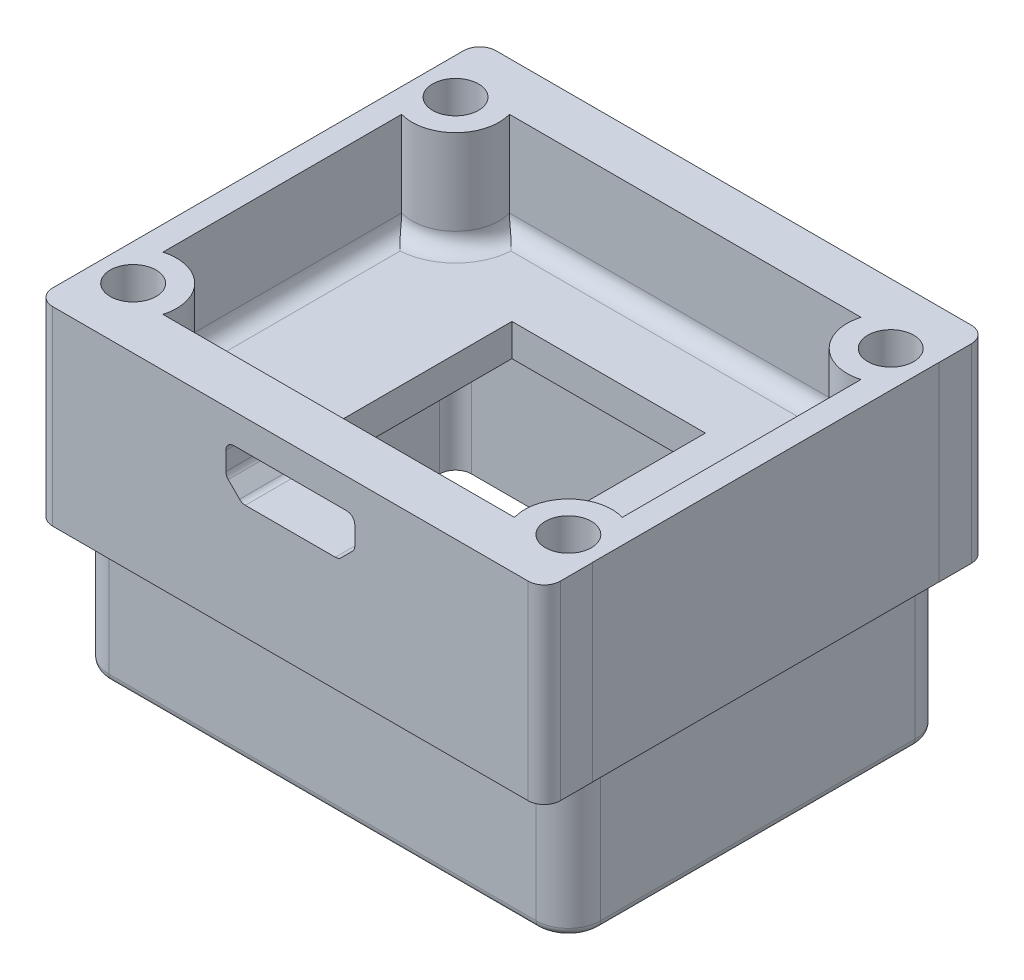
from build123d import *

# Parameters (mm, degrees)
SKETCH_1_W               = 31.500375693
SKETCH_1_H               = 27.5
EXTRUDE_1_DEPTH          = 18.8
SKETCH_2_W               = 0.007172267
SKETCH_2_H               = 21.5
CUT_EXTRUDE_1_DEPTH      = 18.8
SKETCH_3_W               = 30.5
SKETCH_3_H               = 23.5
EXTRUDE_2_DEPTH          = 1.7
SKETCH_4_W               = 28.5
SKETCH_4_H               = 21.5
CUT_EXTRUDE_2_DEPTH      = 12.2
SKETCH_5_W               = 15.8
SKETCH_5_H               = 15.8
EXTRUDE_3_DEPTH          = 0.8
CUT_EXTRUDE_3_DEPTH      = 6.3
SKETCH_7_W               = 14.2
SKETCH_7_H               = 14.2
CUT_EXTRUDE_4_DEPTH      = 0.8
SKETCH_8_W               = 12
SKETCH_8_H               = 12
CUT_EXTRUDE_5_DEPTH      = 26.276152686
CUT_EXTRUDE_6_REACH      = 39.211
HOLE_WIZARD_M2_5_1_D     = 2.85
HOLE_WIZARD_M2_5_1_DEPTH = 5.5
FILLET_1_R               = 2
FILLET_2_R               = 0.5
FILLET_3_R               = 1
CUT_EXTRUDE_8_DEPTH      = 7


with BuildPart() as part:
    # 草图1 → 凸台-拉伸1 (new body)
    with BuildSketch(Plane(origin=(0, 19.5, 0), x_dir=(1, 0, 0), z_dir=(0, 1, 0))):
        with Locations((0.003586134, 0)):
            Rectangle(SKETCH_1_W, SKETCH_1_H)
    extrude(amount=-EXTRUDE_1_DEPTH)

    # 草图2 → 切除-拉伸1 (cut)
    with BuildSketch(Plane.XZ.offset(-0.7)):
        with Locations((15.750187847, 0)):
            Rectangle(SKETCH_2_W, SKETCH_2_H)
    extrude(amount=-CUT_EXTRUDE_1_DEPTH, mode=Mode.SUBTRACT)

    # 草图3 → 凸台-拉伸2 (add)
    with BuildSketch(Plane.XZ.offset(-0.7)):
        Rectangle(SKETCH_3_W, SKETCH_3_H)
    extrude(amount=EXTRUDE_2_DEPTH)

    # 草图4 → 切除-拉伸2 (cut)
    with BuildSketch(Plane.XZ.offset(1)):
        Rectangle(SKETCH_4_W, SKETCH_4_H)
    extrude(amount=-CUT_EXTRUDE_2_DEPTH, mode=Mode.SUBTRACT)

    # 草图5 → 凸台-拉伸3 (add)
    with BuildSketch(Plane.XZ.offset(-11.2)):
        Rectangle(SKETCH_5_W, SKETCH_5_H)
    extrude(amount=EXTRUDE_3_DEPTH)

    # 草图6 → 切除-拉伸3 (cut)
    with BuildSketch(Plane(origin=(0, 19.5, 0), x_dir=(-1, 0, 0), z_dir=(0, 1, 0))):
        with BuildLine():
            Line((-14.25, 7.40625753), (-14.25, -7.40625753))
            ThreePointArc((-14.25, -7.40625753), (-11.590811691, -8.090811691), (-10.90625753, -10.75))
            Line((-10.90625753, -10.75), (10.90625753, -10.75))
            ThreePointArc((10.90625753, -10.75), (11.590811691, -8.090811691), (14.25, -7.40625753))
            Line((14.25, -7.40625753), (14.25, 7.40625753))
            ThreePointArc((14.25, 7.40625753), (11.590811691, 8.090811691), (10.90625753, 10.75))
            Line((10.90625753, 10.75), (-10.90625753, 10.75))
            ThreePointArc((-10.90625753, 10.75), (-11.590811691, 8.090811691), (-14.25, 7.40625753))
        make_face()
    extrude(amount=-CUT_EXTRUDE_3_DEPTH, mode=Mode.SUBTRACT)

    # 草图7 → 切除-拉伸4 (cut)
    with BuildSketch(Plane.XZ.offset(-10.4)):
        Rectangle(SKETCH_7_W, SKETCH_7_H)
    extrude(amount=-CUT_EXTRUDE_4_DEPTH, mode=Mode.SUBTRACT)

    # 草图8 → 切除-拉伸5 (cut, through all)
    with BuildSketch(Plane(origin=(0, 13.2, 0), x_dir=(-1, 0, 0), z_dir=(0, 1, 0))):
        Rectangle(SKETCH_8_W, SKETCH_8_H)
    extrude(amount=-CUT_EXTRUDE_5_DEPTH, mode=Mode.SUBTRACT)

    # 草图9 → 切除-拉伸6 (cut, up to next)
    with BuildSketch(Plane.XY.offset(13.75), mode=Mode.PRIVATE) as cut_extrude_6_sk1:
        Polygon((-4, 17.65), (-4, 15.8), (-3, 14.8), (3, 14.8), (4, 15.8), (4, 17.65), align=None)
    cut_extrude_6_tool1 = extrude(cut_extrude_6_sk1.sketch, amount=-CUT_EXTRUDE_6_REACH, mode=Mode.PRIVATE) & part.part
    add(cut_extrude_6_tool1.solids().sort_by_distance((0, 16.275076, 13.75))[0], mode=Mode.SUBTRACT)

    # M2.5 间隙孔1
    with Locations(Plane(origin=(0, 19.5, 0), x_dir=(1, 0, 0), z_dir=(0, 1, 0))):
        with Locations((13.5, 10), (13.5, -10), (-13.5, -10), (-13.5, 10)):
            Hole(HOLE_WIZARD_M2_5_1_D / 2, depth=HOLE_WIZARD_M2_5_1_DEPTH)

    # 圆角1
    fillet_1_edges = [part.edges().sort_by_distance(p)[0] for p in [
        (15.25, -0.15, -11.75),
        (15.25, -0.15, 11.75),
        (-15.25, -0.15, 11.75),
        (-15.25, -0.15, -11.75),
    ]]
    fillet(fillet_1_edges, radius=FILLET_1_R)

    # 圆角2
    fillet_2_edges = [part.edges().sort_by_distance(p)[0] for p in [
        (-4, 17.65, 12.25),
        (4, 17.65, 12.25),
        (4, 15.8, 12.25),
        (3, 14.8, 12.25),
        (-3, 14.8, 12.25),
        (-4, 15.8, 12.25),
        (-15.25, -1, 0),
        (0, -1, 11.75),
        (15.25, -1, 0),
        (0, -1, -11.75),
        (14.664213562, -1, -11.164213562),
        (-14.664213562, -1, -11.164213562),
        (14.664213562, -1, 11.164213562),
        (-14.664213562, -1, 11.164213562),
    ]]
    fillet(fillet_2_edges, radius=FILLET_2_R)

    # 圆角3
    # the kernel refuses this fillet: 1 mm, written as the material it adds along each edge
    with BuildSketch(Plane(origin=(-14.25, -1, 10.75), x_dir=(1, 0, 0), z_dir=(0, 1, 0))) as fillet_3_piece_1:
        with BuildLine():
            CenterArc((FILLET_3_R, FILLET_3_R), FILLET_3_R, 180, 90)
            Line((0, FILLET_3_R), (0, 0))
            Line((0, 0), (FILLET_3_R, 0))
        make_face()
    extrude(amount=14.7)
    with BuildSketch(Plane(origin=(14.25, -1, 10.75), x_dir=(-1, 0, 0), z_dir=(0, 1, 0)), Plane(origin=(14.25, -1, -10.75), x_dir=(0, 0, 1), z_dir=(0, 1, 0)), Plane(origin=(-14.25, -1, -10.75), x_dir=(1, 0, 0), z_dir=(0, 1, 0))) as fillet_3_piece_2:
        with BuildLine():
            CenterArc((FILLET_3_R, -FILLET_3_R), FILLET_3_R, 90, 90)
            Line((0, -FILLET_3_R), (0, 0))
            Line((0, 0), (FILLET_3_R, 0))
        make_face()
    extrude(amount=14.7)
    with BuildSketch(Plane(origin=(13.5, 13.2, 10), x_dir=(-0.3548034469093428, 0, 0.9349409147434126), z_dir=(0.9349409147434126, 0, 0.3548034469093428))) as fillet_3_piece_3_section:
        with BuildLine():
            CenterArc((2.7 + FILLET_3_R, -FILLET_3_R), FILLET_3_R, 90, 90)
            Line((2.7 + FILLET_3_R, 0), (2.7, 0))
            Line((2.7, 0), (2.7, -FILLET_3_R))
        make_face()
    fillet_3_piece_3 = revolve(axis=Axis((13.5, 13.2, 10), (0, -1, 0)), revolution_arc=228.43720284, mode=Mode.PRIVATE)
    fillet_3_piece_3 = split(fillet_3_piece_3, bisect_by=Plane(origin=(14.25, 13.485154119, 7.889177279), z_dir=(-1, 0, 0)), keep=Keep.TOP, mode=Mode.PRIVATE)
    add(fillet_3_piece_3)
    with BuildSketch(Plane(origin=(-13.40625753, 13.2, 10.75), x_dir=(0, 1, 0), z_dir=(1, 0, 0))) as fillet_3_piece_4_section:
        with BuildLine():
            CenterArc((FILLET_3_R, -FILLET_3_R), FILLET_3_R, 90, 90)
            Line((0, -FILLET_3_R), (0, 0))
            Line((0, 0), (FILLET_3_R, 0))
        make_face()
    fillet_3_piece_4 = extrude(amount=26.81251506, mode=Mode.PRIVATE)
    fillet_3_piece_4 = fillet_3_piece_4 - Plane(origin=(13.5, 14.049901013, 10), x_dir=(-0.9606453592105874, 0, 0.27777777777777996), z_dir=(0, 1, 0)) * Cylinder(2.7, 58, mode=Mode.PRIVATE)
    fillet_3_piece_4 = fillet_3_piece_4 - Plane(origin=(-13.5, 14.049901013, 10), x_dir=(-0.2777777777777764, 0, -0.9606453592105884), z_dir=(0, 1, 0)) * Cylinder(2.7, 58, mode=Mode.PRIVATE)
    add(fillet_3_piece_4)
    with BuildSketch(Plane(origin=(-13.5, 13.2, 10), x_dir=(-0.9349409147434112, 0, -0.35480344690934623), z_dir=(-0.35480344690934623, 0, 0.9349409147434112))) as fillet_3_piece_5_section:
        with BuildLine():
            CenterArc((2.7 + FILLET_3_R, -FILLET_3_R), FILLET_3_R, 90, 90)
            Line((2.7 + FILLET_3_R, 0), (2.7, 0))
            Line((2.7, 0), (2.7, -FILLET_3_R))
        make_face()
    fillet_3_piece_5 = revolve(axis=Axis((-13.5, 13.2, 10), (0, -1, 0)), revolution_arc=228.43720284, mode=Mode.PRIVATE)
    fillet_3_piece_5 = split(fillet_3_piece_5, bisect_by=Plane(origin=(-14.25, 13.485154119, 7.889177279), z_dir=(1, 0, 0)), keep=Keep.TOP, mode=Mode.PRIVATE)
    add(fillet_3_piece_5)
    with BuildSketch(Plane(origin=(-14.25, 13.2, -9.90625753), x_dir=(0, 1, 0), z_dir=(0, 0, 1))) as fillet_3_piece_6_section:
        with BuildLine():
            CenterArc((FILLET_3_R, -FILLET_3_R), FILLET_3_R, 90, 90)
            Line((0, -FILLET_3_R), (0, 0))
            Line((0, 0), (FILLET_3_R, 0))
        make_face()
    fillet_3_piece_6 = extrude(amount=19.81251506, mode=Mode.PRIVATE)
    fillet_3_piece_6 = fillet_3_piece_6 - Plane(origin=(-13.5, 14.049902267, 10), x_dir=(-0.2777777777777764, 0, -0.9606453592105884), z_dir=(0, 1, 0)) * Cylinder(2.7, 44, mode=Mode.PRIVATE)
    fillet_3_piece_6 = fillet_3_piece_6 - Plane(origin=(-13.5, 14.049902267, -10), x_dir=(-1, 0, 0), z_dir=(0, -1, 0)) * Cylinder(1.425, 44, mode=Mode.PRIVATE)
    add(fillet_3_piece_6)
    with BuildSketch(Plane(origin=(-13.5, 13.2, -10), x_dir=(0.35480344690934373, 0, -0.9349409147434123), z_dir=(-0.9349409147434123, 0, -0.35480344690934373))) as fillet_3_piece_7_section:
        with BuildLine():
            CenterArc((2.7 + FILLET_3_R, -FILLET_3_R), FILLET_3_R, 90, 90)
            Line((2.7 + FILLET_3_R, 0), (2.7, 0))
            Line((2.7, 0), (2.7, -FILLET_3_R))
        make_face()
    fillet_3_piece_7 = revolve(axis=Axis((-13.5, 13.2, -10), (0, -1, 0)), revolution_arc=228.43720284, mode=Mode.PRIVATE)
    fillet_3_piece_7 = split(fillet_3_piece_7, bisect_by=Plane(origin=(-14.25, 13.485154119, -7.889177279), z_dir=(1, 0, 0)), keep=Keep.TOP, mode=Mode.PRIVATE)
    add(fillet_3_piece_7)
    with BuildSketch(Plane(origin=(13.40625753, 13.2, -10.75), x_dir=(0, 1, 0), z_dir=(-1, 0, 0))) as fillet_3_piece_8_section:
        with BuildLine():
            CenterArc((FILLET_3_R, -FILLET_3_R), FILLET_3_R, 90, 90)
            Line((0, -FILLET_3_R), (0, 0))
            Line((0, 0), (FILLET_3_R, 0))
        make_face()
    fillet_3_piece_8 = extrude(amount=26.81251506, mode=Mode.PRIVATE)
    fillet_3_piece_8 = fillet_3_piece_8 - Plane(origin=(-13.5, 14.049901014, -10), x_dir=(-1, 0, 0), z_dir=(0, -1, 0)) * Cylinder(1.425, 58, mode=Mode.PRIVATE)
    fillet_3_piece_8 = fillet_3_piece_8 - Plane(origin=(13.5, 14.049901014, -10), x_dir=(-1, 0, 0), z_dir=(0, -1, 0)) * Cylinder(1.425, 58, mode=Mode.PRIVATE)
    add(fillet_3_piece_8)
    with BuildSketch(Plane(origin=(13.5, 13.2, -10), x_dir=(0.9349409147434106, 0, 0.3548034469093482), z_dir=(0.3548034469093482, 0, -0.9349409147434106))) as fillet_3_piece_9_section:
        with BuildLine():
            CenterArc((2.7 + FILLET_3_R, -FILLET_3_R), FILLET_3_R, 90, 90)
            Line((2.7 + FILLET_3_R, 0), (2.7, 0))
            Line((2.7, 0), (2.7, -FILLET_3_R))
        make_face()
    fillet_3_piece_9 = revolve(axis=Axis((13.5, 13.2, -10), (0, -1, 0)), revolution_arc=228.43720284, mode=Mode.PRIVATE)
    fillet_3_piece_9 = split(fillet_3_piece_9, bisect_by=Plane(origin=(14.25, 13.485154119, -7.889177279), z_dir=(-1, 0, 0)), keep=Keep.TOP, mode=Mode.PRIVATE)
    add(fillet_3_piece_9)
    with BuildSketch(Plane(origin=(14.25, 13.2, 9.90625753), x_dir=(0, 1, 0), z_dir=(0, 0, -1))) as fillet_3_piece_10_section:
        with BuildLine():
            CenterArc((FILLET_3_R, -FILLET_3_R), FILLET_3_R, 90, 90)
            Line((0, -FILLET_3_R), (0, 0))
            Line((0, 0), (FILLET_3_R, 0))
        make_face()
    fillet_3_piece_10 = extrude(amount=19.81251506, mode=Mode.PRIVATE)
    fillet_3_piece_10 = fillet_3_piece_10 - Plane(origin=(13.5, 14.049902266, 10), x_dir=(-0.9606453592105874, 0, 0.27777777777777996), z_dir=(0, 1, 0)) * Cylinder(2.7, 44, mode=Mode.PRIVATE)
    fillet_3_piece_10 = fillet_3_piece_10 - Plane(origin=(13.5, 14.049902266, -10), x_dir=(-1, 0, 0), z_dir=(0, -1, 0)) * Cylinder(1.425, 44, mode=Mode.PRIVATE)
    add(fillet_3_piece_10)
    # the kernel refuses this fillet: 1 mm, written as the material it takes off along each edge
    with BuildSketch(Plane(origin=(15.75377398, 22, -13.75), x_dir=(0, 0, 1), z_dir=(0, -1, 0)), Plane(origin=(15.75377398, 22, 13.75), x_dir=(-1, 0, 0), z_dir=(0, -1, 0)), Plane(origin=(-15.746601713, 22, -13.75), x_dir=(1, 0, 0), z_dir=(0, -1, 0))) as fillet_3_2_piece_1:
        with BuildLine():
            CenterArc((FILLET_3_R, FILLET_3_R), FILLET_3_R, 180, 90)
            Line((0, FILLET_3_R), (0, 0))
            Line((0, 0), (FILLET_3_R, 0))
        make_face()
    extrude(amount=23.8, mode=Mode.SUBTRACT)
    with BuildSketch(Plane(origin=(-15.746601713, 22, 13.75), x_dir=(1, 0, 0), z_dir=(0, -1, 0))) as fillet_3_2_piece_2:
        with BuildLine():
            CenterArc((FILLET_3_R, -FILLET_3_R), FILLET_3_R, 90, 90)
            Line((0, -FILLET_3_R), (0, 0))
            Line((0, 0), (FILLET_3_R, 0))
        make_face()
    extrude(amount=23.8, mode=Mode.SUBTRACT)

    # 草图12 → 切除-拉伸8 (cut)
    with BuildSketch(Plane.XZ.offset(-0.7)):
        with BuildLine():
            Line((-15.746601713, 12.75), (-15.746601713, -12.75))
            ThreePointArc((-15.746601713, -12.75), (-15.453708494, -13.457106781), (-14.746601713, -13.75))
            Line((-14.746601713, -13.75), (14.75377398, -13.75))
            ThreePointArc((14.75377398, -13.75), (15.460880761, -13.457106781), (15.75377398, -12.75))
            Line((15.75377398, -12.75), (15.75377398, -10.75))
            Line((15.75377398, -10.75), (15.746601713, -10.75))
            Line((15.746601713, -10.75), (15.746601713, 10.75))
            Line((15.746601713, 10.75), (15.75377398, 10.75))
            Line((15.75377398, 10.75), (15.75377398, 12.75))
            ThreePointArc((15.75377398, 12.75), (15.460880761, 13.457106781), (14.75377398, 13.75))
            Line((14.75377398, 13.75), (-14.746601713, 13.75))
            ThreePointArc((-14.746601713, 13.75), (-15.453708494, 13.457106781), (-15.746601713, 12.75))
        make_face()
        with BuildLine():
            Line((15.25, -9.75), (15.25, 9.75))
            ThreePointArc((15.25, 9.75), (14.664213562, 11.164213562), (13.25, 11.75))
            Line((13.25, 11.75), (-13.25, 11.75))
            ThreePointArc((-13.25, 11.75), (-14.664213562, 11.164213562), (-15.25, 9.75))
            Line((-15.25, 9.75), (-15.25, -9.75))
            ThreePointArc((-15.25, -9.75), (-14.664213562, -11.164213562), (-13.25, -11.75))
            Line((-13.25, -11.75), (13.25, -11.75))
            ThreePointArc((13.25, -11.75), (14.664213562, -11.164213562), (15.25, -9.75))
        make_face(mode=Mode.SUBTRACT)
    extrude(amount=-CUT_EXTRUDE_8_DEPTH, mode=Mode.SUBTRACT)


solid = part.part
